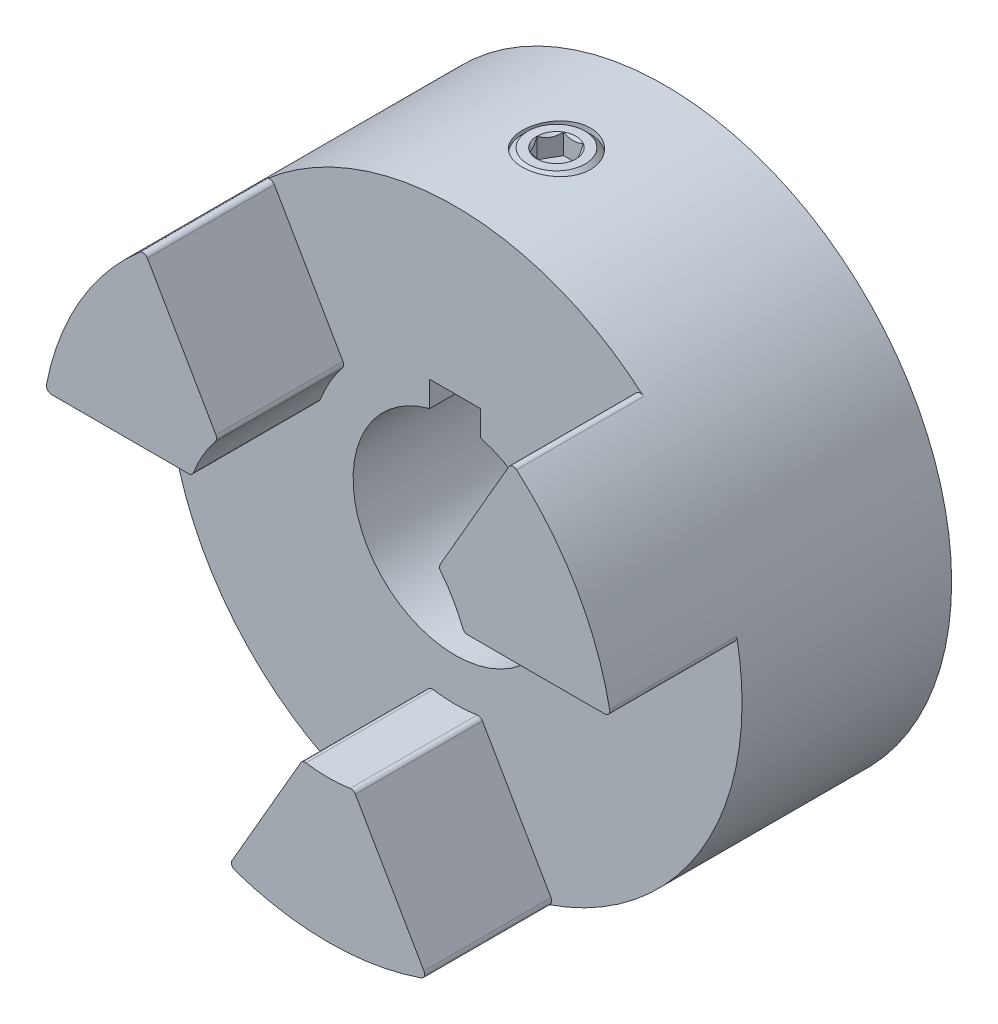
from build123d import *
from OCP.BRepFilletAPI import BRepFilletAPI_MakeChamfer

# Parameters (mm, degrees)
BOSS_EXTRUDE1_START      = -6.746875
SKETCH1_R                = 26.7890625
BOSS_EXTRUDE1_DEPTH      = 20.6375
BOSS_EXTRUDE2_DEPTH      = 11.8618
FILLET1_R                = 0.476990821
CIRPATTERN1_COUNT        = 3
FILLET1_OF_CIRPATTERN1_R = 0.476990821
CUT_EXTRUDE5_DEPTH       = 47.746248335
CUT_EXTRUDE5_DEPTH_BACK  = 47.746248335
SKETCH15_R               = 9.525
CHAMFER1_SIZE            = 1.0715625
CHAMFER1_SIZE2           = 1.588656738
CUT_EXTRUDE1_DEPTH       = 47.746248335
CUT_EXTRUDE1_DEPTH_BACK  = 47.746248335
SKETCH5_R                = 3.175
CUT_EXTRUDE2_DEPTH       = 47.746248335
SKETCH6_R                = 3.175
BOSS_EXTRUDE3_DEPTH      = 7.9375
CUT_EXTRUDE3_DEPTH       = 1.905
CHAMFER3_SIZE            = 0.508
CHAMFER4_SIZE            = 1.0795


with BuildPart() as part:
    # Sketch1 → Boss-Extrude1 (new body)
    with BuildSketch(Plane.XY.offset(BOSS_EXTRUDE1_START)):
        Circle(SKETCH1_R)
    extrude(amount=-BOSS_EXTRUDE1_DEPTH)

    # Sketch2 → Boss-Extrude2 (add)
    with BuildSketch(Plane.XY.offset(-6.746875)):
        with BuildLine():
            Line((-9.238549561, -25.145637229), (-2.384954104, -13.274861682))
            ThreePointArc((-2.384954104, -13.274861682), (0, -13.4874), (2.384954104, -13.274861682))
            Line((2.384954104, -13.274861682), (9.238549561, -25.145637229))
            ThreePointArc((9.238549561, -25.145637229), (0, -26.7890625), (-9.238549561, -25.145637229))
        make_face()
    boss_extrude2 = extrude(amount=BOSS_EXTRUDE2_DEPTH)

    # Fillet1
    # the kernel refuses this fillet: 0.476990821 mm, written as the material it takes off along each edge
    with BuildSketch(Plane(origin=(-9.238549561, -25.145637229, -6.746875), x_dir=(0.9423194959651416, -0.33471475546202245, 0), z_dir=(0, 0, 1))) as fillet1_piece_1:
        with BuildLine():
            CenterArc((0.572952448, 0.476963054), FILLET1_R, 169.55519331, 101.063030663)
            Line((0.103865366, 0.563435893), (0, 0))
            ThreePointArc((0, 0), (0.28904955, -0.001559444), (0.5780991, 0))
        make_face()
    extrude(amount=13.307047751, mode=Mode.SUBTRACT)
    with BuildSketch(Plane(origin=(9.238549561, -25.145637229, -6.746875), x_dir=(-0.9423194959651411, -0.3347147554620237, 0), z_dir=(0, 0, 1))) as fillet1_piece_2:
        with BuildLine():
            CenterArc((0.572952448, -0.476963054), FILLET1_R, 89.381776027, 101.063030663)
            Line((0.103865366, -0.563435893), (0, 0))
            ThreePointArc((0, 0), (0.28904955, 0.001559444), (0.5780991, 0))
        make_face()
    extrude(amount=13.307047751, mode=Mode.SUBTRACT)
    with BuildSketch(Plane(origin=(2.384954104, -13.274861682, -6.746875), x_dir=(0.49999999999999706, -0.8660254037844404, 0), z_dir=(0, 0, 1))) as fillet1_piece_3:
        with BuildLine():
            CenterArc((0.330829178, -0.476990821), FILLET1_R, 90, 68.803855098)
            ThreePointArc((-0.113892323, -0.304529143), (-0.056028498, -0.152607773), (0, 0))
            Line((0, 0), (0.330829178, 0))
        make_face()
    extrude(amount=12.688872944, mode=Mode.SUBTRACT)
    with BuildSketch(Plane(origin=(-2.384954104, -13.274861682, -6.746875), x_dir=(0.9863015455813384, -0.16495229972286882, 0), z_dir=(0, 0, 1))) as fillet1_piece_4:
        with BuildLine():
            CenterArc((0.330879129, -0.476956172), FILLET1_R, 90.690608377, 68.803855098)
            Line((-0.115888763, -0.309867293), (0, 0))
            ThreePointArc((0, 0), (0.162564956, -0.000979741), (0.325129912, 0))
        make_face()
    extrude(amount=12.688872944, mode=Mode.SUBTRACT)

    # CirPattern1: Boss-Extrude2 ×3 about axis
    cirpattern1_axis = Axis((0, 0, 0), (0, 0, 1))
    for i in range(1, CIRPATTERN1_COUNT):
        add(boss_extrude2.rotate(cirpattern1_axis, i * 360 / CIRPATTERN1_COUNT))

    # Fillet1 of CirPattern1
    # the kernel refuses this fillet: 0.476990821 mm, written as the material it takes off along each edge
    with BuildSketch(Plane(origin=(26.396035415, 4.572, -6.746875), x_dir=(-0.18128826673094764, 0.9834299997181745, 0), z_dir=(0, 0, 1)), Plane(origin=(-17.157485854, 20.573637229, -6.746875), x_dir=(-0.761031229234182, -0.6487152442561451, 0), z_dir=(0, 0, 1))) as fillet1_of_cirpattern1_piece_1:
        with BuildLine():
            CenterArc((0.572952448, 0.476963054), FILLET1_OF_CIRPATTERN1_R, 169.55519331, 101.063030663)
            Line((0.103865366, 0.563435893), (0, 0))
            ThreePointArc((0, 0), (0.28904955, -0.001559444), (0.5780991, 0))
        make_face()
    extrude(amount=13.307047751, mode=Mode.SUBTRACT)
    with BuildSketch(Plane(origin=(17.157485854, 20.573637229, -6.746875), x_dir=(0.7610312292341833, -0.6487152442561435, 0), z_dir=(0, 0, 1)), Plane(origin=(-26.396035415, 4.572, -6.746875), x_dir=(0.181288266730962, 0.9834299997181718, 0), z_dir=(0, 0, 1))) as fillet1_of_cirpattern1_piece_2:
        with BuildLine():
            CenterArc((0.572952448, -0.476963054), FILLET1_OF_CIRPATTERN1_R, 89.381776027, 101.063030663)
            Line((0.103865366, -0.563435893), (0, 0))
            ThreePointArc((0, 0), (0.28904955, 0.001559444), (0.5780991, 0))
        make_face()
    extrude(amount=13.307047751, mode=Mode.SUBTRACT)
    with BuildSketch(Plane(origin=(10.303890396, 8.702861682, -6.746875), x_dir=(0.5000000000000006, 0.8660254037844383, 0), z_dir=(0, 0, 1)), Plane(origin=(-12.688844501, 4.572, -6.746875), x_dir=(-1, 0, 0), z_dir=(0, 0, 1))) as fillet1_of_cirpattern1_piece_3:
        with BuildLine():
            CenterArc((0.330829178, -0.476990821), FILLET1_OF_CIRPATTERN1_R, 90, 68.803855098)
            ThreePointArc((-0.113892323, -0.304529143), (-0.056028498, -0.152607773), (0, 0))
            Line((0, 0), (0.330829178, 0))
        make_face()
    extrude(amount=12.688872944, mode=Mode.SUBTRACT)
    with BuildSketch(Plane(origin=(12.688844501, 4.572, -6.746875), x_dir=(-0.3502978908180006, 0.9366383441267288, 0), z_dir=(0, 0, 1)), Plane(origin=(-10.303890396, 8.702861682, -6.746875), x_dir=(-0.6360036547633316, -0.7716860444038657, 0), z_dir=(0, 0, 1))) as fillet1_of_cirpattern1_piece_4:
        with BuildLine():
            CenterArc((0.330879129, -0.476956172), FILLET1_OF_CIRPATTERN1_R, 90.690608377, 68.803855098)
            Line((-0.115888763, -0.309867293), (0, 0))
            ThreePointArc((0, 0), (0.162564956, -0.000979741), (0.325129912, 0))
        make_face()
    extrude(amount=12.688872944, mode=Mode.SUBTRACT)

    # Sketch15 → Cut-Extrude5 (cut, two sides: drawn at the far end of the back side and taken through both)
    with BuildSketch(Plane.XY.offset(-CUT_EXTRUDE5_DEPTH_BACK)):
        Circle(SKETCH15_R)
    extrude(amount=CUT_EXTRUDE5_DEPTH + CUT_EXTRUDE5_DEPTH_BACK, mode=Mode.SUBTRACT)

    # Chamfer1: one chamfer whose edges measure the first distance from different faces: ONE call of the kernel's chamfer builder (chamfer() names one face for all edges)
    chamfer1_edges_1 = [part.edges().sort_by_distance(p)[0] for p in [
        (-26.7890625, 0, -27.384375),
    ]]
    chamfer1_side_1 = [part.faces().sort_by_distance(p)[0] for p in [
        (-26.7890625, 0, -17.065625),
    ]]
    chamfer1_edges_2 = [part.edges().sort_by_distance(p)[0] for p in [
        (-9.525, 0, -27.384375),
    ]]
    chamfer1_side_2 = [part.faces().sort_by_distance(p)[0] for p in [
        (-9.525, 0, -17.065625),
    ]]
    chamfer1 = BRepFilletAPI_MakeChamfer(part.part.solid().wrapped)
    for e in chamfer1_edges_1:
        chamfer1.Add(CHAMFER1_SIZE, CHAMFER1_SIZE2, e.wrapped, chamfer1_side_1[0].wrapped)  # the first distance lies on this face
    for e in chamfer1_edges_2:
        chamfer1.Add(CHAMFER1_SIZE, CHAMFER1_SIZE2, e.wrapped, chamfer1_side_2[0].wrapped)  # the first distance lies on this face
    add(Compound.cast(chamfer1.Shape()), mode=Mode.REPLACE)

    # Sketch4 → Cut-Extrude1 (cut, two sides: drawn at the far end of the back side and taken through both)
    with BuildSketch(Plane.XY.offset(-CUT_EXTRUDE1_DEPTH_BACK)):
        with BuildLine():
            Line((-2.38125, 11.603791593), (2.38125, 11.603791593))
            Line((2.38125, 11.603791593), (2.38125, 9.222541593))
            ThreePointArc((2.38125, 9.222541593), (0, 9.525), (-2.38125, 9.222541593))
            Line((-2.38125, 9.222541593), (-2.38125, 11.603791593))
        make_face()
    extrude(amount=CUT_EXTRUDE1_DEPTH + CUT_EXTRUDE1_DEPTH_BACK, mode=Mode.SUBTRACT)

    # Sketch5 → Cut-Extrude2 (cut, through all)
    with BuildSketch(Plane(origin=(0, 0, 0), x_dir=(1, 0, 0), z_dir=(0, 1, 0))):
        with Locations(Location((0, 16.208375, 0), (0, 0, 90))):
            Circle(SKETCH5_R)
    extrude(amount=CUT_EXTRUDE2_DEPTH, mode=Mode.SUBTRACT)


with BuildPart() as body_2:
    # Sketch6 → Boss-Extrude3 (new body)
    with BuildSketch(Plane(origin=(0, 26.7890625, 0), x_dir=(-1, 0, 0), z_dir=(0, 1, 0))):
        with Locations(Location((0, -16.208375, 0), (0, 0, 90))):
            Circle(SKETCH6_R)
    extrude(amount=-BOSS_EXTRUDE3_DEPTH)

    # Sketch8 → Cut-Extrude3 (cut)
    with BuildSketch(Plane(origin=(0, 26.7890625, 0), x_dir=(1, 0, 0), z_dir=(0, 1, 0))):
        Polygon((0.916543552, 14.620875), (1.833087105, 16.208375), (0.916543552, 17.795875), (-0.916543552, 17.795875), (-1.833087105, 16.208375), (-0.916543552, 14.620875), align=None)
    extrude(amount=-CUT_EXTRUDE3_DEPTH, mode=Mode.SUBTRACT)

    # Cut-Extrude4 cone 1 section (through the dimple's axis) → Cut-Extrude4 (revolve, cut)
    with BuildSketch(Plane(origin=(0, 26.7890625, -16.208375), x_dir=(0, 0, 1), z_dir=(1, 0, 0))):
        Polygon((0, 0), (1.833087105, 0), (0, 1.833087105), align=None)
    revolve(axis=Axis((0, 26.7890625, -16.208375), (0, -1, 0)), mode=Mode.SUBTRACT)

    # Chamfer3
    chamfer3_edges = [body_2.edges().sort_by_distance(p)[0] for p in [
        (0, 26.7890625, -19.383375),
    ]]
    chamfer(chamfer3_edges, length=CHAMFER3_SIZE)

    # Chamfer4
    chamfer4_edges = [body_2.edges().sort_by_distance(p)[0] for p in [
        (0, 18.8515625, -19.383375),
    ]]
    chamfer(chamfer4_edges, length=CHAMFER4_SIZE)


solid = Compound([part.part, body_2.part])
